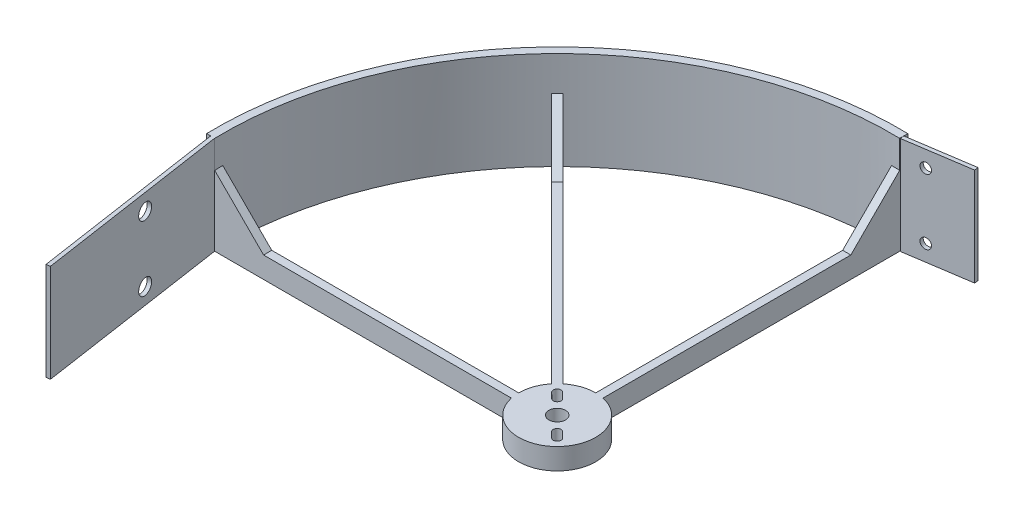
from build123d import *

# Parameters (mm, degrees)
SKETCH1_R            = 15
BOSS_EXTRUDE2_DEPTH  = 8.255
BOSS_EXTRUDE3_DEPTH  = 8.255
BOSS_EXTRUDE4_DEPTH  = 38.1
SKETCH5_R            = 3.249999977
CUT_EXTRUDE3_DEPTH   = 63.5
BOSS_EXTRUDE13_DEPTH = 3.175
BOSS_EXTRUDE14_DEPTH = 3.175
BOSS_EXTRUDE15_DEPTH = 3.175
CUT_EXTRUDE6_DEPTH   = 191.932367672
SKETCH20_W           = 38.1
SKETCH20_H           = 25.4
BOSS_EXTRUDE16_DEPTH = 1.524
SKETCH21_W           = 38.1
SKETCH21_H           = 76.2
BOSS_EXTRUDE17_DEPTH = 1.524
SKETCH23_R           = 3
CUT_EXTRUDE7_DEPTH   = 2.54
SKETCH24_R           = 1.98501
CUT_EXTRUDE8_DEPTH   = 2.54


with BuildPart() as part:
    # Sketch1 → Boss-Extrude2 (new body)
    with BuildSketch(Plane(origin=(0, 0, 0), x_dir=(1, 0, 0), z_dir=(0, 1, 0))):
        Circle(SKETCH1_R)
    extrude(amount=BOSS_EXTRUDE2_DEPTH)

    # Sketch1<6> → Boss-Extrude3 (add)
    with BuildSketch(Plane(origin=(0, 0, 0), x_dir=(1, 0, 0), z_dir=(0, 1, 0))):
        with BuildLine():
            ThreePointArc((3.175, 130.136274728), (1.587618078, 130.165318322), (0, 130.175))
            Line((0, 130.175), (0, 15))
            ThreePointArc((0, 15), (1.596569562, 14.914790164), (3.175, 14.660128751))
            Line((3.175, 14.660128751), (3.175, 130.136274728))
        make_face()
        with BuildLine():
            Line((-9.42450178, 11.66956581), (-90.918248264, 93.163312294))
            ThreePointArc((-90.918248264, 93.163312294), (-92.047625241, 92.047625241), (-93.163312294, 90.918248264))
            Line((-93.163312294, 90.918248264), (-11.66956581, 9.42450178))
            ThreePointArc((-11.66956581, 9.42450178), (-10.606601718, 10.606601718), (-9.42450178, 11.66956581))
        make_face()
        with BuildLine():
            Line((-15, 0), (-130.175, 0))
            ThreePointArc((-130.175, 0), (-130.165318322, -1.587618078), (-130.136274728, -3.175))
            Line((-130.136274728, -3.175), (-14.660128751, -3.175))
            ThreePointArc((-14.660128751, -3.175), (-14.914790164, -1.596569562), (-15, 0))
        make_face()
    extrude(amount=BOSS_EXTRUDE3_DEPTH)

    # Sketch1<7> → Boss-Extrude4 (add)
    with BuildSketch(Plane(origin=(0, 0, 0), x_dir=(1, 0, 0), z_dir=(0, 1, 0))):
        with BuildLine():
            ThreePointArc((-90.918248264, 93.163312294), (-49.08154667, 120.567542902), (0, 130.175))
            ThreePointArc((0, 130.175), (1.587618078, 130.165318322), (3.175, 130.136274728))
            Line((3.175, 130.136274728), (3.175, 133.312197023))
            ThreePointArc((3.175, 133.312197023), (-94.292689271, 94.292689271), (-133.312197023, -3.175))
            Line((-133.312197023, -3.175), (-130.136274728, -3.175))
            ThreePointArc((-130.136274728, -3.175), (-130.165318322, -1.587618078), (-130.175, 0))
            ThreePointArc((-130.175, 0), (-120.567542902, 49.08154667), (-93.163312294, 90.918248264))
            ThreePointArc((-93.163312294, 90.918248264), (-92.047625241, 92.047625241), (-90.918248264, 93.163312294))
        make_face()
    extrude(amount=BOSS_EXTRUDE4_DEPTH)

    # Sketch5 → Cut-Extrude3 (cut)
    with BuildSketch(Plane(origin=(0, 8.255, 0), x_dir=(1, 0, 0), z_dir=(0, 1, 0))):
        Circle(SKETCH5_R)
    extrude(amount=-CUT_EXTRUDE3_DEPTH, mode=Mode.SUBTRACT)

    # Sketch14 → Boss-Extrude13 (add)
    with BuildSketch(Plane(origin=(0, 0, 0), x_dir=(-1, 0, 0), z_dir=(0, 0, -1))):
        Polygon((130.175, 8.255), (111.125, 8.255), (130.175, 27.305), align=None)
    extrude(amount=-BOSS_EXTRUDE13_DEPTH)

    # Sketch15 → Boss-Extrude14 (add)
    with BuildSketch(Plane.ZY):
        Polygon((-130.175, 8.255), (-130.175, 27.305), (-111.125, 8.255), align=None)
    extrude(amount=-BOSS_EXTRUDE14_DEPTH)

    # Sketch16 → Boss-Extrude15 (add)
    with BuildSketch(Plane(origin=(1.122532015, 0, -1.122532015), x_dir=(-0.7071067811865476, 0, -0.7071067811865475), z_dir=(0.7071067811865475, 0, -0.7071067811865476))):
        Polygon((133.340319762, 8.255), (111.115319762, 8.255), (133.340319762, 27.305), align=None)
    extrude(amount=-BOSS_EXTRUDE15_DEPTH)

    # Sketch17 → Cut-Extrude6 (cut, through all)
    with BuildSketch(Plane(origin=(0, 8.255, 0), x_dir=(1, 0, 0), z_dir=(0, 1, 0))):
        with BuildLine():
            Line((-6.64538953, 4.490128061), (-8.800650999, 6.64538953))
            ThreePointArc((-8.800650999, 6.64538953), (-8.800650999, 8.800650999), (-6.64538953, 8.800650999))
            Line((-6.64538953, 8.800650999), (-4.490128061, 6.64538953))
            ThreePointArc((-4.490128061, 6.64538953), (-4.490128061, 4.490128061), (-6.64538953, 4.490128061))
        make_face()
        with BuildLine():
            Line((4.490128061, -6.64538953), (6.64538953, -8.800650999))
            ThreePointArc((6.64538953, -8.800650999), (8.800650999, -8.800650999), (8.800650999, -6.64538953))
            Line((8.800650999, -6.64538953), (6.64538953, -4.490128061))
            ThreePointArc((6.64538953, -4.490128061), (4.490128061, -4.490128061), (4.490128061, -6.64538953))
        make_face()
    extrude(amount=-CUT_EXTRUDE6_DEPTH, mode=Mode.SUBTRACT)

    # Sketch21 → Boss-Extrude17 (add)
    with BuildSketch(Plane(origin=(-129.31051464, 0, 19.325585898), x_dir=(0, -1, 0), z_dir=(-0.9890158633619175, 0, 0.14780941112960724))):
        with Locations((-19.05, 21.77004363)):
            Rectangle(SKETCH21_W, SKETCH21_H)
    extrude(amount=-BOSS_EXTRUDE17_DEPTH)

    # Sketch23 → Cut-Extrude7 (cut)
    with BuildSketch(Plane(origin=(-129.31051464, 0, 19.325585898), x_dir=(0.14780941112960713, 0, 0.9890158633619174), z_dir=(-0.9890158633619175, 0, 0.14780941112960716))):
        with Locations((16.04488363, 31.75)):
            Circle(SKETCH23_R)
        with Locations((16.04488363, 6.35)):
            Circle(SKETCH23_R)
    extrude(amount=-CUT_EXTRUDE7_DEPTH, mode=Mode.SUBTRACT)


with BuildPart() as body_2:
    # Sketch20 → Boss-Extrude16 (new body)
    with BuildSketch(Plane(origin=(-19.404962867, 0, -128.309337557), x_dir=(0, -1, 0), z_dir=(-0.14953534344371316, 0, -0.9887563810470053))):
        with Locations((-19.05, -35.536730361)):
            Rectangle(SKETCH20_W, SKETCH20_H)
    extrude(amount=-BOSS_EXTRUDE16_DEPTH)

    # Sketch24 → Cut-Extrude8 (cut)
    with BuildSketch(Plane(origin=(-19.404962867, 0, -128.309337557), x_dir=(-0.9887563810470054, 0, 0.14953534344371316), z_dir=(-0.14953534344371314, 0, -0.9887563810470053))):
        with Locations((-31.489274046, 31.75)):
            Circle(SKETCH24_R)
        with Locations((-31.489274046, 6.35)):
            Circle(SKETCH24_R)
    extrude(amount=-CUT_EXTRUDE8_DEPTH, mode=Mode.SUBTRACT)


solid = Compound([part.part, body_2.part])
